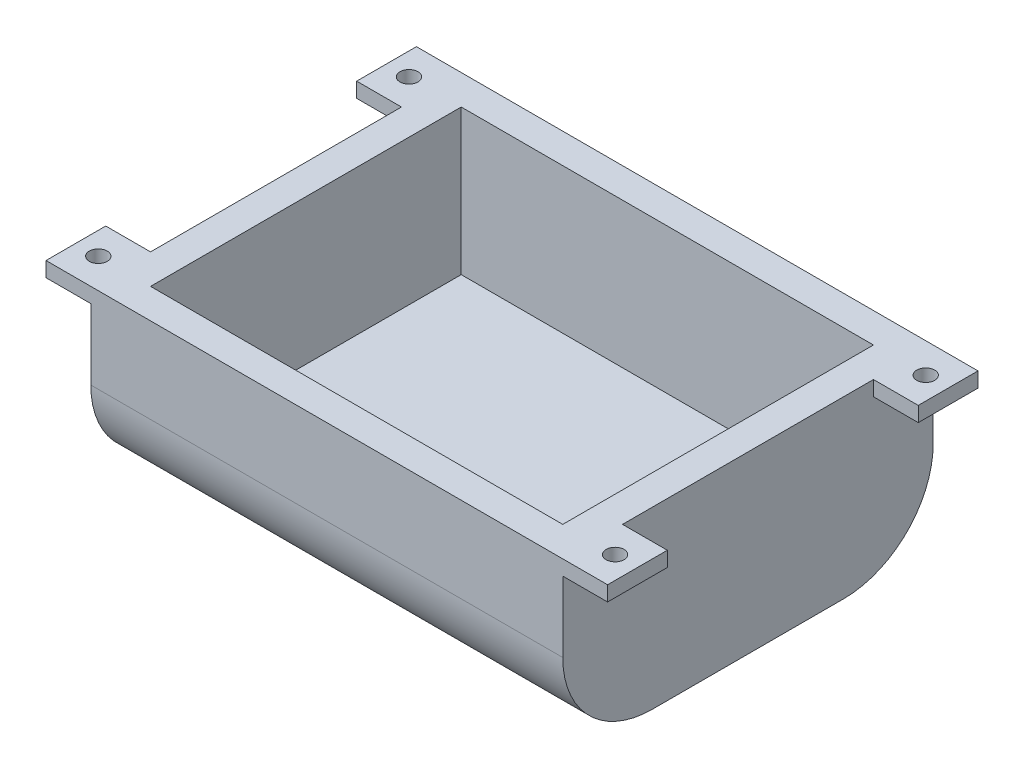
from build123d import *

# Parameters (mm, degrees)
SKETCH1_W               = 79
SKETCH1_H               = 62
SKETCH1_W_2             = 69
SKETCH1_H_2             = 52
BOSS_EXTRUDE1_DEPTH     = 24.3
SKETCH1_2_W             = 79
SKETCH1_2_H             = 62
BOSS_EXTRUDE2_DEPTH     = 5
SKETCH3_W               = 10
SKETCH3_H               = 2.5
BOSS_EXTRUDE3_DEPTH     = 7.5
CUT_EXTRUDE1_DEPTH      = 63.355753544
CUT_EXTRUDE1_DEPTH_BACK = 63.355753544
SKETCH4_R               = 1.5
FILLET1_R               = 15


with BuildPart() as part:
    # Sketch1 → Boss-Extrude1 (new body)
    with BuildSketch(Plane(origin=(0, 0, 0), x_dir=(1, 0, 0), z_dir=(0, 1, 0))):
        Rectangle(SKETCH1_W, SKETCH1_H)
        Rectangle(SKETCH1_W_2, SKETCH1_H_2, mode=Mode.SUBTRACT)
    extrude(amount=BOSS_EXTRUDE1_DEPTH)

    # Sketch1<2> → Boss-Extrude2 (add)
    with BuildSketch(Plane(origin=(0, 0, 0), x_dir=(1, 0, 0), z_dir=(0, 1, 0))):
        Rectangle(SKETCH1_2_W, SKETCH1_2_H)
    extrude(amount=-BOSS_EXTRUDE2_DEPTH)

    # Sketch3 → Boss-Extrude3 (add)
    with BuildSketch(Plane.ZY.offset(39.5)):
        with Locations((-26, 23.05)):
            Rectangle(SKETCH3_W, SKETCH3_H)
        with Locations((26, 23.05)):
            Rectangle(SKETCH3_W, SKETCH3_H)
    boss_extrude3 = extrude(amount=BOSS_EXTRUDE3_DEPTH)

    # Mirror1: Boss-Extrude3 across plane
    add(boss_extrude3.mirror(Plane.ZY))

    # Sketch4 → Cut-Extrude1 (cut, two sides: drawn at the far end of the back side and taken through both)
    with BuildSketch(Plane.XZ.offset(-21.8).offset(-CUT_EXTRUDE1_DEPTH_BACK)):
        with Locations((43.25, 26)):
            Circle(SKETCH4_R)
        with Locations((-43.25, 26)):
            Circle(SKETCH4_R)
        with Locations((-43.25, -26)):
            Circle(SKETCH4_R)
        with Locations((43.25, -26)):
            Circle(SKETCH4_R)
    extrude(amount=CUT_EXTRUDE1_DEPTH + CUT_EXTRUDE1_DEPTH_BACK, mode=Mode.SUBTRACT)

    # Fillet1
    fillet1_edges = [part.edges().sort_by_distance(p)[0] for p in [
        (0, -5, -31),
        (0, -5, 31),
    ]]
    fillet(fillet1_edges, radius=FILLET1_R)


solid = part.part
